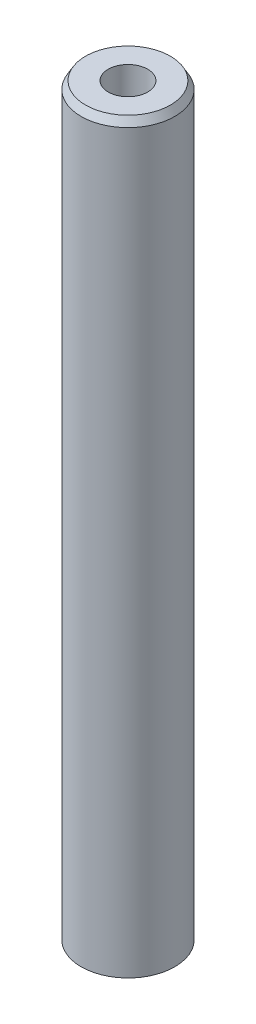
from build123d import *
from OCP.BRepFilletAPI import BRepFilletAPI_MakeChamfer

# Parameters (mm, degrees)
SKETCH1_R           = 20
BOSS_EXTRUDE1_DEPTH = 319.761376586
SKETCH2_R           = 8.450537925
CUT_EXTRUDE1_DEPTH  = 322.009872054
CHAMFER1_SIZE       = 3.268459681
CHAMFER1_SIZE2      = 1.887046077


with BuildPart() as part:
    # Sketch1 → Boss-Extrude1 (new body)
    with BuildSketch(Plane(origin=(0, 0, 0), x_dir=(1, 0, 0), z_dir=(0, 1, 0))):
        Circle(SKETCH1_R)
    extrude(amount=BOSS_EXTRUDE1_DEPTH)

    # Sketch2 → Cut-Extrude1 (cut, through all)
    with BuildSketch(Plane(origin=(0, 0, 0), x_dir=(1, 0, 0), z_dir=(0, 1, 0))):
        Circle(SKETCH2_R)
    extrude(amount=CUT_EXTRUDE1_DEPTH, mode=Mode.SUBTRACT)

    # Chamfer1: one chamfer whose edges measure the first distance from different faces: ONE call of the kernel's chamfer builder (chamfer() names one face for all edges)
    chamfer1_edges_1 = [part.edges().sort_by_distance(p)[0] for p in [
        (-20, 319.761376586, 0),
    ]]
    chamfer1_side_1 = [part.faces().sort_by_distance(p)[0] for p in [
        (-20, 159.880688293, 0),
    ]]
    chamfer1_edges_2 = [part.edges().sort_by_distance(p)[0] for p in [
        (-20, 0, 0),
    ]]
    chamfer1_side_2 = [part.faces().sort_by_distance(p)[0] for p in [
        (-19.434314575, 0, 0),
    ]]
    chamfer1 = BRepFilletAPI_MakeChamfer(part.part.solid().wrapped)
    for e in chamfer1_edges_1:
        chamfer1.Add(CHAMFER1_SIZE, CHAMFER1_SIZE2, e.wrapped, chamfer1_side_1[0].wrapped)  # the first distance lies on this face
    for e in chamfer1_edges_2:
        chamfer1.Add(CHAMFER1_SIZE, CHAMFER1_SIZE2, e.wrapped, chamfer1_side_2[0].wrapped)  # the first distance lies on this face
    add(Compound.cast(chamfer1.Shape()), mode=Mode.REPLACE)


solid = part.part
